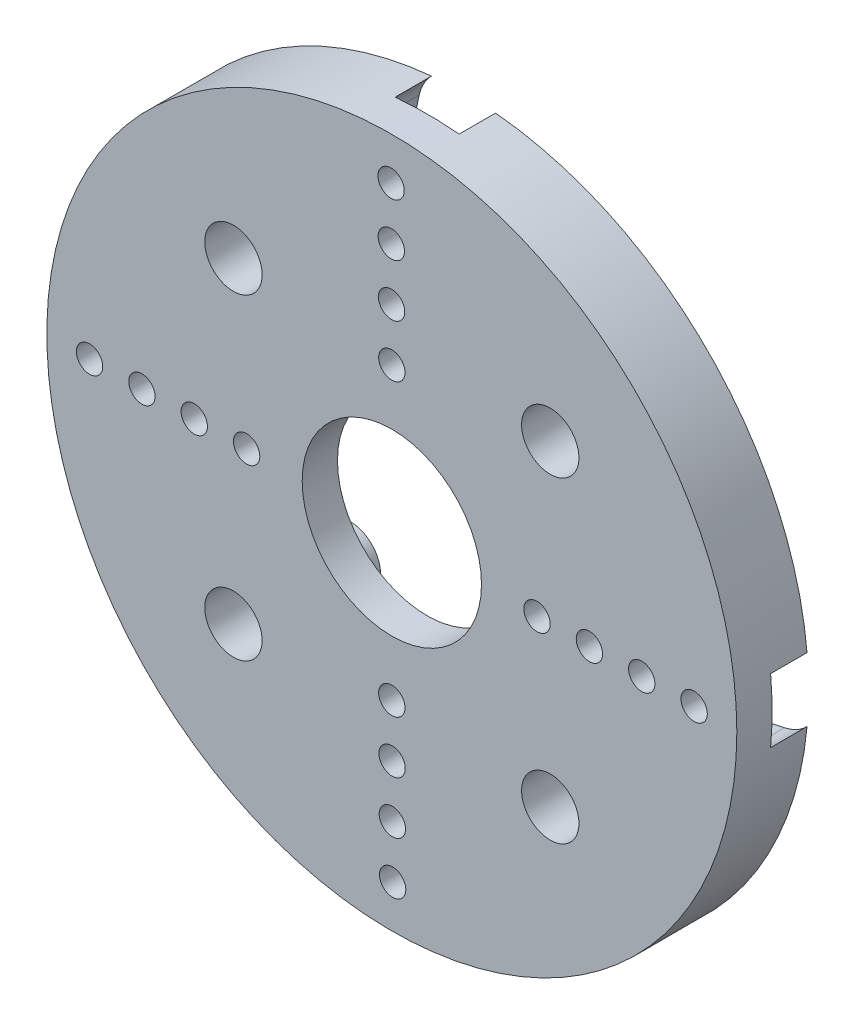
from build123d import *

# Parameters (mm, degrees)
SKETCH1_R             = 19.25
BOSS_EXTRUDE1_DEPTH   = 4
CAVITY1_OUTLINE_R     = 0.635
CAVITY1_OUTLINE_R_2   = 2.9845
CAVITY1_DEPTH         = 2.032
CAVITY1_2_DEPTH       = 1.397
CAVITY1_START         = 0.6858
CAVITY1_3_OUTLINE_R   = 2.9845
CAVITY1_3_OUTLINE_R_2 = 1.4605
CAVITY1_3_DEPTH       = 0.7112
CAVITY1_START_2       = 2.032
CAVITY1_4_OUTLINE_R   = 19.25
CAVITY1_4_OUTLINE_R_2 = 2.9845
CAVITY1_4_DEPTH       = 0.635
SKETCH3_R             = 0.735
CUT_EXTRUDE2_DEPTH    = 28.515904492
SKETCH5_R             = 5.001570325
CUT_EXTRUDE4_DEPTH    = 4
CUT_EXTRUDE1_START    = -2.032
CUT_EXTRUDE1_DEPTH    = 2.032
CUT_EXTRUDE5_REACH    = 29.516
SKETCH6_R             = 1.6


with BuildPart() as part:
    # Sketch1 → Boss-Extrude1 (new body)
    with BuildSketch(Plane.XY):
        Circle(SKETCH1_R)
    extrude(amount=BOSS_EXTRUDE1_DEPTH)

    # Cavity1: read off the stored shape, not the designer's step
    # Cavity1 outline → Cavity1 (cut)
    with BuildSketch(Plane.XY):
        with BuildLine():
            Line((4.1275, 7.873032293), (1.983814648, 17.804306789))
            ThreePointArc((1.983814648, 17.804306789), (1.57335187, 18.658067023), (0.820101074, 19.232522825))
            ThreePointArc((0.820101074, 19.232522825), (0, 19.25), (-0.820101074, 19.232522825))
            ThreePointArc((-0.820101074, 19.232522825), (-1.57335187, 18.658067023), (-1.983814648, 17.804306789))
            Line((-1.983814648, 17.804306789), (-4.1275, 7.873032293))
            Line((-4.1275, 7.873032293), (-4.1275, 6.316065522))
            ThreePointArc((-4.1275, 6.316065522), (-4.768516, 4.768516), (-6.316065522, 4.1275))
            Line((-6.316065522, 4.1275), (-7.873032293, 4.1275))
            Line((-7.873032293, 4.1275), (-17.804306789, 1.983814648))
            ThreePointArc((-17.804306789, 1.983814648), (-18.658067023, 1.57335187), (-19.232522825, 0.820101074))
            ThreePointArc((-19.232522825, 0.820101074), (-19.25, 0), (-19.232522825, -0.820101074))
            ThreePointArc((-19.232522825, -0.820101074), (-18.658067023, -1.57335187), (-17.804306789, -1.983814648))
            Line((-17.804306789, -1.983814648), (-7.873032293, -4.1275))
            Line((-7.873032293, -4.1275), (-6.316065522, -4.1275))
            ThreePointArc((-6.316065522, -4.1275), (-4.768516, -4.768516), (-4.1275, -6.316065522))
            Line((-4.1275, -6.316065522), (-4.1275, -7.873032293))
            Line((-4.1275, -7.873032293), (-1.983814648, -17.804306789))
            ThreePointArc((-1.983814648, -17.804306789), (-1.57335187, -18.658067023), (-0.820101074, -19.232522825))
            ThreePointArc((-0.820101074, -19.232522825), (0, -19.25), (0.820101074, -19.232522825))
            ThreePointArc((0.820101074, -19.232522825), (1.57335187, -18.658067023), (1.983814648, -17.804306789))
            Line((1.983814648, -17.804306789), (4.1275, -7.873032293))
            Line((4.1275, -7.873032293), (4.1275, -6.316065522))
            ThreePointArc((4.1275, -6.316065522), (4.768516, -4.768516), (6.316065522, -4.1275))
            Line((6.316065522, -4.1275), (7.873032293, -4.1275))
            Line((7.873032293, -4.1275), (17.804306789, -1.983814648))
            ThreePointArc((17.804306789, -1.983814648), (18.658067023, -1.57335187), (19.232522825, -0.820101074))
            ThreePointArc((19.232522825, -0.820101074), (19.25, 0), (19.232522825, 0.820101074))
            ThreePointArc((19.232522825, 0.820101074), (18.658067023, 1.57335187), (17.804306789, 1.983814648))
            Line((17.804306789, 1.983814648), (7.873032293, 4.1275))
            Line((7.873032293, 4.1275), (6.316065522, 4.1275))
            ThreePointArc((6.316065522, 4.1275), (4.768516, 4.768516), (4.1275, 6.316065522))
            Line((4.1275, 6.316065522), (4.1275, 7.873032293))
        make_face()
        with Locations((-16.865495273, -0.042841993)):
            Circle(CAVITY1_OUTLINE_R, mode=Mode.SUBTRACT)
        with Locations((-13.944530182, -0.028561329)):
            Circle(CAVITY1_OUTLINE_R, mode=Mode.SUBTRACT)
        with Locations((-11.023565091, -0.014280664)):
            Circle(CAVITY1_OUTLINE_R, mode=Mode.SUBTRACT)
        with BuildLine():
            ThreePointArc((-0.381, -4.683528584), (-1.798229449, -4.341309923), (-3.042347138, -3.581162505))
            Line((-3.042347138, -3.581162505), (-2.230589816, -2.769405184))
            ThreePointArc((-2.230589816, -2.769405184), (-1.360822285, -3.285315618), (-0.381, -3.53553037))
            Line((-0.381, -3.53553037), (-0.381, -4.683528584))
        make_face(mode=Mode.SUBTRACT)
        with BuildLine():
            ThreePointArc((-3.581162505, -3.042347138), (-4.341309923, -1.798229449), (-4.683528584, -0.381))
            Line((-4.683528584, -0.381), (-3.53553037, -0.381))
            ThreePointArc((-3.53553037, -0.381), (-3.285315618, -1.360822285), (-2.769405184, -2.230589816))
            Line((-2.769405184, -2.230589816), (-3.581162505, -3.042347138))
        make_face(mode=Mode.SUBTRACT)
        with Locations((0.042841993, -16.865495273)):
            Circle(CAVITY1_OUTLINE_R, mode=Mode.SUBTRACT)
        with Locations((0.028561329, -13.944530182)):
            Circle(CAVITY1_OUTLINE_R, mode=Mode.SUBTRACT)
        with Locations((0.014280664, -11.023565091)):
            Circle(CAVITY1_OUTLINE_R, mode=Mode.SUBTRACT)
        with Locations((0, -8.1026)):
            Circle(CAVITY1_OUTLINE_R, mode=Mode.SUBTRACT)
        with BuildLine():
            ThreePointArc((3.042347138, -3.581162505), (1.798229449, -4.341309923), (0.381, -4.683528584))
            Line((0.381, -4.683528584), (0.381, -3.53553037))
            ThreePointArc((0.381, -3.53553037), (1.360822285, -3.285315618), (2.230589816, -2.769405184))
            Line((2.230589816, -2.769405184), (3.042347138, -3.581162505))
        make_face(mode=Mode.SUBTRACT)
        with BuildLine():
            ThreePointArc((4.683528584, -0.381), (4.341309923, -1.798229449), (3.581162505, -3.042347138))
            Line((3.581162505, -3.042347138), (2.769405184, -2.230589816))
            ThreePointArc((2.769405184, -2.230589816), (3.285315618, -1.360822285), (3.53553037, -0.381))
            Line((3.53553037, -0.381), (4.683528584, -0.381))
        make_face(mode=Mode.SUBTRACT)
        with Locations((-8.1026, 0)):
            Circle(CAVITY1_OUTLINE_R, mode=Mode.SUBTRACT)
        with BuildLine():
            ThreePointArc((-4.683528584, 0.381), (-4.341309923, 1.798229449), (-3.581162505, 3.042347138))
            Line((-3.581162505, 3.042347138), (-2.769405184, 2.230589816))
            ThreePointArc((-2.769405184, 2.230589816), (-3.285315618, 1.360822285), (-3.53553037, 0.381))
            Line((-3.53553037, 0.381), (-4.683528584, 0.381))
        make_face(mode=Mode.SUBTRACT)
        with BuildLine():
            ThreePointArc((-3.042347138, 3.581162505), (-1.798229449, 4.341309923), (-0.381, 4.683528584))
            Line((-0.381, 4.683528584), (-0.381, 3.53553037))
            ThreePointArc((-0.381, 3.53553037), (-1.360822285, 3.285315618), (-2.230589816, 2.769405184))
            Line((-2.230589816, 2.769405184), (-3.042347138, 3.581162505))
        make_face(mode=Mode.SUBTRACT)
        with Locations((-0.014280664, 11.023565091)):
            Circle(CAVITY1_OUTLINE_R, mode=Mode.SUBTRACT)
        with Locations((-0.028561329, 13.944530182)):
            Circle(CAVITY1_OUTLINE_R, mode=Mode.SUBTRACT)
        with Locations((-0.042841993, 16.865495273)):
            Circle(CAVITY1_OUTLINE_R, mode=Mode.SUBTRACT)
        Circle(CAVITY1_OUTLINE_R_2, mode=Mode.SUBTRACT)
        with BuildLine():
            ThreePointArc((3.581162505, 3.042347138), (4.341309923, 1.798229449), (4.683528584, 0.381))
            Line((4.683528584, 0.381), (3.53553037, 0.381))
            ThreePointArc((3.53553037, 0.381), (3.285315618, 1.360822285), (2.769405184, 2.230589816))
            Line((2.769405184, 2.230589816), (3.581162505, 3.042347138))
        make_face(mode=Mode.SUBTRACT)
        with BuildLine():
            ThreePointArc((0.381, 4.683528584), (1.798229449, 4.341309923), (3.042347138, 3.581162505))
            Line((3.042347138, 3.581162505), (2.230589816, 2.769405184))
            ThreePointArc((2.230589816, 2.769405184), (1.360822285, 3.285315618), (0.381, 3.53553037))
            Line((0.381, 3.53553037), (0.381, 4.683528584))
        make_face(mode=Mode.SUBTRACT)
        with Locations((8.1026, 0)):
            Circle(CAVITY1_OUTLINE_R, mode=Mode.SUBTRACT)
        with Locations((0, 8.1026)):
            Circle(CAVITY1_OUTLINE_R, mode=Mode.SUBTRACT)
        with Locations((11.023565091, 0.014280664)):
            Circle(CAVITY1_OUTLINE_R, mode=Mode.SUBTRACT)
        with Locations((13.944530182, 0.028561329)):
            Circle(CAVITY1_OUTLINE_R, mode=Mode.SUBTRACT)
        with Locations((16.865495273, 0.042841993)):
            Circle(CAVITY1_OUTLINE_R, mode=Mode.SUBTRACT)
    extrude(amount=CAVITY1_DEPTH, mode=Mode.SUBTRACT)

    # Cavity1 2 outline → Cavity1 2 (cut)
    with BuildSketch(Plane.XY):
        with BuildLine():
            Line((2.230589816, 2.769405184), (3.042347138, 3.581162505))
            ThreePointArc((3.042347138, 3.581162505), (1.798229449, 4.341309923), (0.381, 4.683528584))
            Line((0.381, 4.683528584), (0.381, 3.53553037))
            ThreePointArc((0.381, 3.53553037), (1.360822285, 3.285315618), (2.230589816, 2.769405184))
        make_face()
        with BuildLine():
            Line((3.53553037, 0.381), (4.683528584, 0.381))
            ThreePointArc((4.683528584, 0.381), (4.341309923, 1.798229449), (3.581162505, 3.042347138))
            Line((3.581162505, 3.042347138), (2.769405184, 2.230589816))
            ThreePointArc((2.769405184, 2.230589816), (3.285315618, 1.360822285), (3.53553037, 0.381))
        make_face()
        with BuildLine():
            Line((2.769405184, -2.230589816), (3.581162505, -3.042347138))
            ThreePointArc((3.581162505, -3.042347138), (4.341309923, -1.798229449), (4.683528584, -0.381))
            Line((4.683528584, -0.381), (3.53553037, -0.381))
            ThreePointArc((3.53553037, -0.381), (3.285315618, -1.360822285), (2.769405184, -2.230589816))
        make_face()
        with BuildLine():
            Line((0.381, -3.53553037), (0.381, -4.683528584))
            ThreePointArc((0.381, -4.683528584), (1.798229449, -4.341309923), (3.042347138, -3.581162505))
            Line((3.042347138, -3.581162505), (2.230589816, -2.769405184))
            ThreePointArc((2.230589816, -2.769405184), (1.360822285, -3.285315618), (0.381, -3.53553037))
        make_face()
        with BuildLine():
            Line((-2.230589816, -2.769405184), (-3.042347138, -3.581162505))
            ThreePointArc((-3.042347138, -3.581162505), (-1.798229449, -4.341309923), (-0.381, -4.683528584))
            Line((-0.381, -4.683528584), (-0.381, -3.53553037))
            ThreePointArc((-0.381, -3.53553037), (-1.360822285, -3.285315618), (-2.230589816, -2.769405184))
        make_face()
        with BuildLine():
            Line((-3.53553037, -0.381), (-4.683528584, -0.381))
            ThreePointArc((-4.683528584, -0.381), (-4.341309923, -1.798229449), (-3.581162505, -3.042347138))
            Line((-3.581162505, -3.042347138), (-2.769405184, -2.230589816))
            ThreePointArc((-2.769405184, -2.230589816), (-3.285315618, -1.360822285), (-3.53553037, -0.381))
        make_face()
        with BuildLine():
            Line((-2.769405184, 2.230589816), (-3.581162505, 3.042347138))
            ThreePointArc((-3.581162505, 3.042347138), (-4.341309923, 1.798229449), (-4.683528584, 0.381))
            Line((-4.683528584, 0.381), (-3.53553037, 0.381))
            ThreePointArc((-3.53553037, 0.381), (-3.285315618, 1.360822285), (-2.769405184, 2.230589816))
        make_face()
        with BuildLine():
            Line((-0.381, 3.53553037), (-0.381, 4.683528584))
            ThreePointArc((-0.381, 4.683528584), (-1.798229449, 4.341309923), (-3.042347138, 3.581162505))
            Line((-3.042347138, 3.581162505), (-2.230589816, 2.769405184))
            ThreePointArc((-2.230589816, 2.769405184), (-1.360822285, 3.285315618), (-0.381, 3.53553037))
        make_face()
    extrude(amount=CAVITY1_2_DEPTH, mode=Mode.SUBTRACT)

    # Cavity1 3 outline → Cavity1 3 (cut)
    with BuildSketch(Plane.XY.offset(CAVITY1_START)):
        Circle(CAVITY1_3_OUTLINE_R)
        Circle(CAVITY1_3_OUTLINE_R_2, mode=Mode.SUBTRACT)
    extrude(amount=CAVITY1_3_DEPTH, mode=Mode.SUBTRACT)

    # Cavity1 4 outline → Cavity1 4 (cut)
    with BuildSketch(Plane.XY.offset(CAVITY1_START_2)):
        Circle(CAVITY1_4_OUTLINE_R)
        with BuildLine():
            Line((-3.042347138, -3.581162505), (-2.230589816, -2.769405184))
            ThreePointArc((-2.230589816, -2.769405184), (-1.360822285, -3.285315618), (-0.381, -3.53553037))
            Line((-0.381, -3.53553037), (-0.381, -4.683528584))
            ThreePointArc((-0.381, -4.683528584), (-1.798229449, -4.341309923), (-3.042347138, -3.581162505))
        make_face(mode=Mode.SUBTRACT)
        with BuildLine():
            ThreePointArc((-3.53553037, -0.381), (-3.285315618, -1.360822285), (-2.769405184, -2.230589816))
            Line((-2.769405184, -2.230589816), (-3.581162505, -3.042347138))
            ThreePointArc((-3.581162505, -3.042347138), (-4.341309923, -1.798229449), (-4.683528584, -0.381))
            Line((-4.683528584, -0.381), (-3.53553037, -0.381))
        make_face(mode=Mode.SUBTRACT)
        with BuildLine():
            Line((0.381, -4.683528584), (0.381, -3.53553037))
            ThreePointArc((0.381, -3.53553037), (1.360822285, -3.285315618), (2.230589816, -2.769405184))
            Line((2.230589816, -2.769405184), (3.042347138, -3.581162505))
            ThreePointArc((3.042347138, -3.581162505), (1.798229449, -4.341309923), (0.381, -4.683528584))
        make_face(mode=Mode.SUBTRACT)
        with BuildLine():
            Line((3.581162505, -3.042347138), (2.769405184, -2.230589816))
            ThreePointArc((2.769405184, -2.230589816), (3.285315618, -1.360822285), (3.53553037, -0.381))
            Line((3.53553037, -0.381), (4.683528584, -0.381))
            ThreePointArc((4.683528584, -0.381), (4.341309923, -1.798229449), (3.581162505, -3.042347138))
        make_face(mode=Mode.SUBTRACT)
        with BuildLine():
            Line((-3.581162505, 3.042347138), (-2.769405184, 2.230589816))
            ThreePointArc((-2.769405184, 2.230589816), (-3.285315618, 1.360822285), (-3.53553037, 0.381))
            Line((-3.53553037, 0.381), (-4.683528584, 0.381))
            ThreePointArc((-4.683528584, 0.381), (-4.341309923, 1.798229449), (-3.581162505, 3.042347138))
        make_face(mode=Mode.SUBTRACT)
        with BuildLine():
            Line((-0.381, 4.683528584), (-0.381, 3.53553037))
            ThreePointArc((-0.381, 3.53553037), (-1.360822285, 3.285315618), (-2.230589816, 2.769405184))
            Line((-2.230589816, 2.769405184), (-3.042347138, 3.581162505))
            ThreePointArc((-3.042347138, 3.581162505), (-1.798229449, 4.341309923), (-0.381, 4.683528584))
        make_face(mode=Mode.SUBTRACT)
        Circle(CAVITY1_4_OUTLINE_R_2, mode=Mode.SUBTRACT)
        with BuildLine():
            Line((4.683528584, 0.381), (3.53553037, 0.381))
            ThreePointArc((3.53553037, 0.381), (3.285315618, 1.360822285), (2.769405184, 2.230589816))
            Line((2.769405184, 2.230589816), (3.581162505, 3.042347138))
            ThreePointArc((3.581162505, 3.042347138), (4.341309923, 1.798229449), (4.683528584, 0.381))
        make_face(mode=Mode.SUBTRACT)
        with BuildLine():
            ThreePointArc((0.381, 4.683528584), (1.798229449, 4.341309923), (3.042347138, 3.581162505))
            Line((3.042347138, 3.581162505), (2.230589816, 2.769405184))
            ThreePointArc((2.230589816, 2.769405184), (1.360822285, 3.285315618), (0.381, 3.53553037))
            Line((0.381, 3.53553037), (0.381, 4.683528584))
        make_face(mode=Mode.SUBTRACT)
    extrude(amount=CAVITY1_4_DEPTH, mode=Mode.SUBTRACT)

    # Cavity1 5 outline → Cavity1 5 (revolve)
    with BuildSketch(Plane.XZ):
        Polygon((4.701570325, 2.032), (19.25, 2.032), (19.25, 2.667), (3.555999999, 2.667), align=None)
    revolve(axis=Axis((0, 0, 0), (0, 0, 1)))

    # Sketch3 → Cut-Extrude2 (cut, through all)
    with BuildSketch(Plane(origin=(0, 0, 0), x_dir=(-1, 0, 0), z_dir=(0, 0, -1))):
        with Locations((16.865495273, -0.042841993)):
            Circle(SKETCH3_R)
        with Locations((13.944530182, -0.028561329)):
            Circle(SKETCH3_R)
        with Locations((11.023565091, -0.014280664)):
            Circle(SKETCH3_R)
        with Locations((8.1026, 0)):
            Circle(SKETCH3_R)
        with Locations((-0.042841993, -16.865495273)):
            Circle(SKETCH3_R)
        with Locations((-0.028561329, -13.944530182)):
            Circle(SKETCH3_R)
        with Locations((-0.014280664, -11.023565091)):
            Circle(SKETCH3_R)
        with Locations((0, -8.1026)):
            Circle(SKETCH3_R)
        with Locations((-16.865495273, 0.042841993)):
            Circle(SKETCH3_R)
        with Locations((-13.944530182, 0.028561329)):
            Circle(SKETCH3_R)
        with Locations((-11.023565091, 0.014280664)):
            Circle(SKETCH3_R)
        with Locations((-8.1026, 0)):
            Circle(SKETCH3_R)
        with Locations((0, 8.1026)):
            Circle(SKETCH3_R)
        with Locations((0.014280664, 11.023565091)):
            Circle(SKETCH3_R)
        with Locations((0.028561329, 13.944530182)):
            Circle(SKETCH3_R)
        with Locations((0.042841993, 16.865495273)):
            Circle(SKETCH3_R)
    extrude(amount=-CUT_EXTRUDE2_DEPTH, mode=Mode.SUBTRACT)

    # Sketch5 → Cut-Extrude4 (cut)
    with BuildSketch(Plane(origin=(0, 0, 0), x_dir=(-1, 0, 0), z_dir=(0, 0, -1))):
        Circle(SKETCH5_R)
    extrude(amount=-CUT_EXTRUDE4_DEPTH, mode=Mode.SUBTRACT)

    # Sketch2 → Cut-Extrude1 (cut)
    with BuildSketch(Plane(origin=(0, 0, 0), x_dir=(-1, 0, 0), z_dir=(0, 0, -1)).offset(CUT_EXTRUDE1_START)):
        with BuildLine():
            Line((-2.472558472, 17.909803115), (-4.6275, 7.926380958))
            Line((-4.6275, 7.926380958), (-4.6275, 6.316065522))
            ThreePointArc((-4.6275, 6.316065522), (-5.122069391, 5.122069391), (-6.316065522, 4.6275))
            Line((-6.316065522, 4.6275), (-7.926380958, 4.6275))
            Line((-7.926380958, 4.6275), (-17.909803115, 2.472558472))
            ThreePointArc((-17.909803115, 2.472558472), (-19.011904483, 1.929383395), (-19.72804541, 0.930980289))
            ThreePointArc((-19.72804541, 0.930980289), (-19.75, 0), (-19.72804541, -0.930980289))
            ThreePointArc((-19.72804541, -0.930980289), (-19.011904483, -1.929383395), (-17.909803115, -2.472558472))
            Line((-17.909803115, -2.472558472), (-7.926380958, -4.6275))
            Line((-7.926380958, -4.6275), (-6.316065522, -4.6275))
            ThreePointArc((-6.316065522, -4.6275), (-5.122069391, -5.122069391), (-4.6275, -6.316065522))
            Line((-4.6275, -6.316065522), (-4.6275, -7.926380958))
            Line((-4.6275, -7.926380958), (-2.472558472, -17.909803115))
            ThreePointArc((-2.472558472, -17.909803115), (-1.929383395, -19.011904483), (-0.930980289, -19.72804541))
            ThreePointArc((-0.930980289, -19.72804541), (0, -19.75), (0.930980289, -19.72804541))
            ThreePointArc((0.930980289, -19.72804541), (1.929383395, -19.011904483), (2.472558472, -17.909803115))
            Line((2.472558472, -17.909803115), (4.6275, -7.926380958))
            Line((4.6275, -7.926380958), (4.6275, -6.316065522))
            ThreePointArc((4.6275, -6.316065522), (5.122069391, -5.122069391), (6.316065522, -4.6275))
            Line((6.316065522, -4.6275), (7.926380958, -4.6275))
            Line((7.926380958, -4.6275), (17.909803115, -2.472558472))
            ThreePointArc((17.909803115, -2.472558472), (19.011904483, -1.929383395), (19.72804541, -0.930980289))
            ThreePointArc((19.72804541, -0.930980289), (19.75, 0), (19.72804541, 0.930980289))
            ThreePointArc((19.72804541, 0.930980289), (19.011904483, 1.929383395), (17.909803115, 2.472558472))
            Line((17.909803115, 2.472558472), (7.926380958, 4.6275))
            Line((7.926380958, 4.6275), (6.316065522, 4.6275))
            ThreePointArc((6.316065522, 4.6275), (5.122069391, 5.122069391), (4.6275, 6.316065522))
            Line((4.6275, 6.316065522), (4.6275, 7.926380958))
            Line((4.6275, 7.926380958), (2.472558472, 17.909803115))
            ThreePointArc((2.472558472, 17.909803115), (1.929383395, 19.011904483), (0.930980289, 19.72804541))
            ThreePointArc((0.930980289, 19.72804541), (0, 19.75), (-0.930980289, 19.72804541))
            ThreePointArc((-0.930980289, 19.72804541), (-1.929383395, 19.011904483), (-2.472558472, 17.909803115))
        make_face()
        with BuildLine():
            Line((-1.983814648, 17.804306789), (-4.1275, 7.873032293))
            Line((-4.1275, 7.873032293), (-4.1275, 6.316065522))
            ThreePointArc((-4.1275, 6.316065522), (-4.768516, 4.768516), (-6.316065522, 4.1275))
            Line((-6.316065522, 4.1275), (-7.873032293, 4.1275))
            Line((-7.873032293, 4.1275), (-17.804306789, 1.983814648))
            ThreePointArc((-17.804306789, 1.983814648), (-18.658067023, 1.57335187), (-19.232522825, 0.820101074))
            ThreePointArc((-19.232522825, 0.820101074), (-19.25, 0), (-19.232522825, -0.820101074))
            ThreePointArc((-19.232522825, -0.820101074), (-18.658067023, -1.57335187), (-17.804306789, -1.983814648))
            Line((-17.804306789, -1.983814648), (-7.873032293, -4.1275))
            Line((-7.873032293, -4.1275), (-6.316065522, -4.1275))
            ThreePointArc((-6.316065522, -4.1275), (-4.768516, -4.768516), (-4.1275, -6.316065522))
            Line((-4.1275, -6.316065522), (-4.1275, -7.873032293))
            Line((-4.1275, -7.873032293), (-1.983814648, -17.804306789))
            ThreePointArc((-1.983814648, -17.804306789), (-1.57335187, -18.658067023), (-0.820101074, -19.232522825))
            ThreePointArc((-0.820101074, -19.232522825), (0, -19.25), (0.820101074, -19.232522825))
            ThreePointArc((0.820101074, -19.232522825), (1.57335187, -18.658067023), (1.983814648, -17.804306789))
            Line((1.983814648, -17.804306789), (4.1275, -7.873032293))
            Line((4.1275, -7.873032293), (4.1275, -6.316065522))
            ThreePointArc((4.1275, -6.316065522), (4.768516, -4.768516), (6.316065522, -4.1275))
            Line((6.316065522, -4.1275), (7.873032293, -4.1275))
            Line((7.873032293, -4.1275), (17.804306789, -1.983814648))
            ThreePointArc((17.804306789, -1.983814648), (18.658067023, -1.57335187), (19.232522825, -0.820101074))
            ThreePointArc((19.232522825, -0.820101074), (19.25, 0), (19.232522825, 0.820101074))
            ThreePointArc((19.232522825, 0.820101074), (18.658067023, 1.57335187), (17.804306789, 1.983814648))
            Line((17.804306789, 1.983814648), (7.873032293, 4.1275))
            Line((7.873032293, 4.1275), (6.316065522, 4.1275))
            ThreePointArc((6.316065522, 4.1275), (4.768516, 4.768516), (4.1275, 6.316065522))
            Line((4.1275, 6.316065522), (4.1275, 7.873032293))
            Line((4.1275, 7.873032293), (1.983814648, 17.804306789))
            ThreePointArc((1.983814648, 17.804306789), (1.57335187, 18.658067023), (0.820101074, 19.232522825))
            ThreePointArc((0.820101074, 19.232522825), (0, 19.25), (-0.820101074, 19.232522825))
            ThreePointArc((-0.820101074, 19.232522825), (-1.57335187, 18.658067023), (-1.983814648, 17.804306789))
        make_face(mode=Mode.SUBTRACT)
    extrude(amount=CUT_EXTRUDE1_DEPTH, mode=Mode.SUBTRACT)

    # Sketch6 → Cut-Extrude5 (cut, up to next)
    with BuildSketch(Plane.XY.offset(4), mode=Mode.PRIVATE) as cut_extrude5_sk1:
        with Locations((8.838834765, 8.838834765)):
            Circle(SKETCH6_R)
    cut_extrude5_tool1 = extrude(cut_extrude5_sk1.sketch, amount=-CUT_EXTRUDE5_REACH, mode=Mode.PRIVATE) & part.part
    # Sketch6 → Cut-Extrude5 (cut, up to next)
    with BuildSketch(Plane.XY.offset(4), mode=Mode.PRIVATE) as cut_extrude5_sk2:
        with Locations((8.838834765, -8.838834765)):
            Circle(SKETCH6_R)
    cut_extrude5_tool2 = extrude(cut_extrude5_sk2.sketch, amount=-CUT_EXTRUDE5_REACH, mode=Mode.PRIVATE) & part.part
    # Sketch6 → Cut-Extrude5 (cut, up to next)
    with BuildSketch(Plane.XY.offset(4), mode=Mode.PRIVATE) as cut_extrude5_sk3:
        with Locations((-8.838834765, 8.838834765)):
            Circle(SKETCH6_R)
    cut_extrude5_tool3 = extrude(cut_extrude5_sk3.sketch, amount=-CUT_EXTRUDE5_REACH, mode=Mode.PRIVATE) & part.part
    # Sketch6 → Cut-Extrude5 (cut, up to next)
    with BuildSketch(Plane.XY.offset(4), mode=Mode.PRIVATE) as cut_extrude5_sk4:
        with Locations((-8.838834765, -8.838834765)):
            Circle(SKETCH6_R)
    cut_extrude5_tool4 = extrude(cut_extrude5_sk4.sketch, amount=-CUT_EXTRUDE5_REACH, mode=Mode.PRIVATE) & part.part
    add(cut_extrude5_tool1.solids().sort_by_distance((8.838835, 8.838835, 4))[0], mode=Mode.SUBTRACT)
    add(cut_extrude5_tool2.solids().sort_by_distance((8.838835, -8.838835, 4))[0], mode=Mode.SUBTRACT)
    add(cut_extrude5_tool3.solids().sort_by_distance((-8.838835, 8.838835, 4))[0], mode=Mode.SUBTRACT)
    add(cut_extrude5_tool4.solids().sort_by_distance((-8.838835, -8.838835, 4))[0], mode=Mode.SUBTRACT)


solid = part.part
